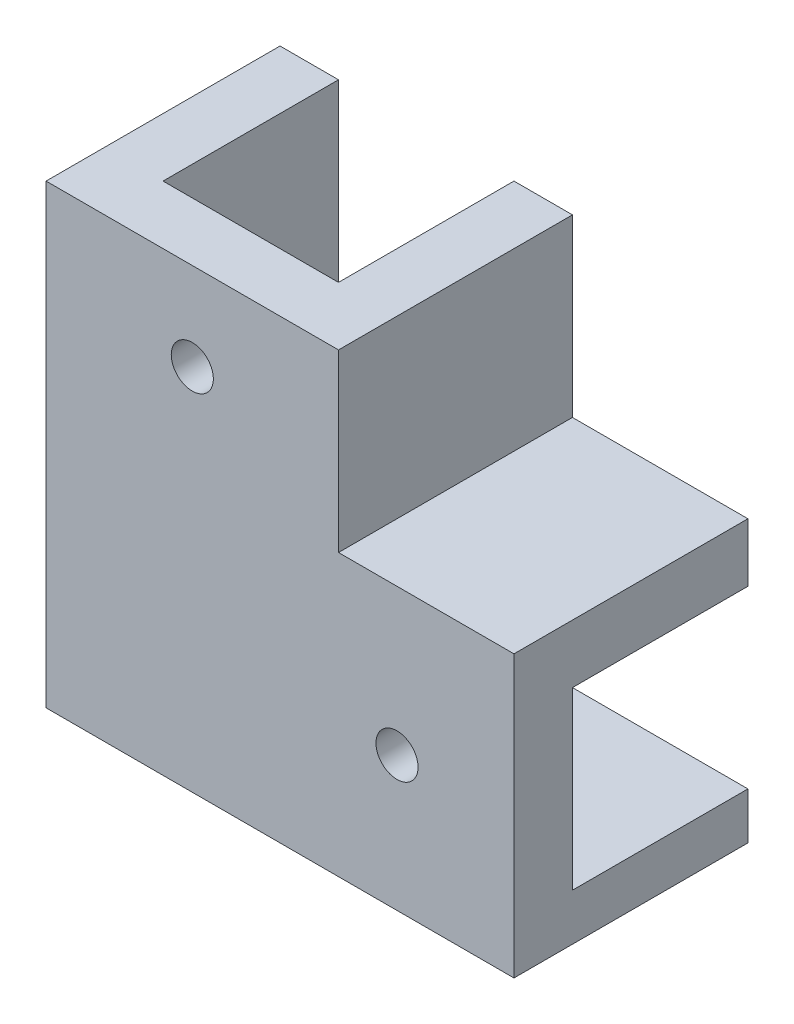
from build123d import *

# Parameters (mm, degrees)
BOSS_EXTRUDE1_DEPTH = 5
BOSS_EXTRUDE2_DEPTH = 15
SKETCH3_W           = 5
SKETCH3_H           = 35
BOSS_EXTRUDE3_DEPTH = 15
SKETCH4_W           = 5
SKETCH4_H           = 35
BOSS_EXTRUDE4_DEPTH = 5
BOSS_EXTRUDE5_DEPTH = 5
SKETCH7_R           = 1.8
CUT_EXTRUDE1_DEPTH  = 41.565958567
SKETCH9_W           = 5
SKETCH9_H           = 15
BOSS_EXTRUDE6_DEPTH = 10
BOSS_EXTRUDE7_DEPTH = 4
SKETCH13_R          = 1.5
CUT_EXTRUDE4_DEPTH  = 54.857287961


with BuildPart() as part:
    # Sketch1 → Boss-Extrude1 (new body)
    with BuildSketch(Plane.XY):
        Polygon((-7.529880478, -25.806772908), (27.470119522, -25.806772908), (27.470119522, -10.806772908), (7.470119522, -10.806772908), (7.470119522, 9.193227092), (-7.529880478, 9.193227092), align=None)
    extrude(amount=BOSS_EXTRUDE1_DEPTH)



with BuildPart() as body_2:
    # Sketch2 → Boss-Extrude2 (new body)
    with BuildSketch(Plane(origin=(0, 0, 0), x_dir=(-1, 0, 0), z_dir=(0, 0, -1))):
        Polygon((-7.470119522, 9.193227092), (-12.470119522, 9.193227092), (-12.470119522, -5.806772908), (-27.470119522, -5.806772908), (-27.470119522, -10.806772908), (-7.470119522, -10.806772908), align=None)
    extrude(amount=BOSS_EXTRUDE2_DEPTH)


with BuildPart() as body_3:
    # Sketch3 → Boss-Extrude3 (new body)
    with BuildSketch(Plane(origin=(0, 0, 0), x_dir=(-1, 0, 0), z_dir=(0, 0, -1))):
        with Locations((10.029880478, -8.306772908)):
            Rectangle(SKETCH3_W, SKETCH3_H)
    extrude(amount=BOSS_EXTRUDE3_DEPTH)


with BuildPart() as part_1:
    add(part.part)

    add(body_3.part)  # Boss-Extrude4 merges body 3
    # Sketch4 → Boss-Extrude4 (add)
    with BuildSketch(Plane.XY):
        with Locations((-10.029880478, -8.306772908)):
            Rectangle(SKETCH4_W, SKETCH4_H)
    extrude(amount=BOSS_EXTRUDE4_DEPTH)


    add(body_2.part)  # Boss-Extrude5 merges body 2
    # Sketch5 → Boss-Extrude5 (add)
    with BuildSketch(Plane.XY):
        Polygon((7.470119522, 9.193227092), (7.470119522, -10.806772908), (27.470119522, -10.806772908), (27.470119522, -5.806772908), (12.470119522, -5.806772908), (12.470119522, 9.193227092), align=None)
    extrude(amount=BOSS_EXTRUDE5_DEPTH)

    # Sketch7 → Cut-Extrude1 (cut, through all)
    with BuildSketch(Plane(origin=(0, 0, 0), x_dir=(-1, 0, 0), z_dir=(0, 0, -1))):
        with Locations((0.029880478, 1.693227092)):
            Circle(SKETCH7_R)
        with Locations((-17.470119522, -18.306772908)):
            Circle(SKETCH7_R)
    extrude(amount=-CUT_EXTRUDE1_DEPTH, mode=Mode.SUBTRACT)

    # Sketch9 → Boss-Extrude6 (add)
    with BuildSketch(Plane(origin=(0, 0, -15), x_dir=(-1, 0, 0), z_dir=(0, 0, -1))):
        with Locations((10.029880478, -18.306772908)):
            Rectangle(SKETCH9_W, SKETCH9_H)
    extrude(amount=BOSS_EXTRUDE6_DEPTH)

    # Sketch12 → Boss-Extrude7 (add)
    with BuildSketch(Plane.XZ.offset(25.806772908)):
        Polygon((7.470119522, -25), (-12.529880478, -25), (-12.529880478, 5), (7.470119522, 5), (27.470119522, 5), (27.470119522, -15), (7.470119522, -15), align=None)
    extrude(amount=BOSS_EXTRUDE7_DEPTH)

    # Sketch13 → Cut-Extrude4 (cut, through all)
    with BuildSketch(Plane.XZ.offset(29.806772908)):
        with Locations((-0.029880478, -20)):
            Circle(SKETCH13_R)
    extrude(amount=-CUT_EXTRUDE4_DEPTH, mode=Mode.SUBTRACT)


solid = part_1.part
